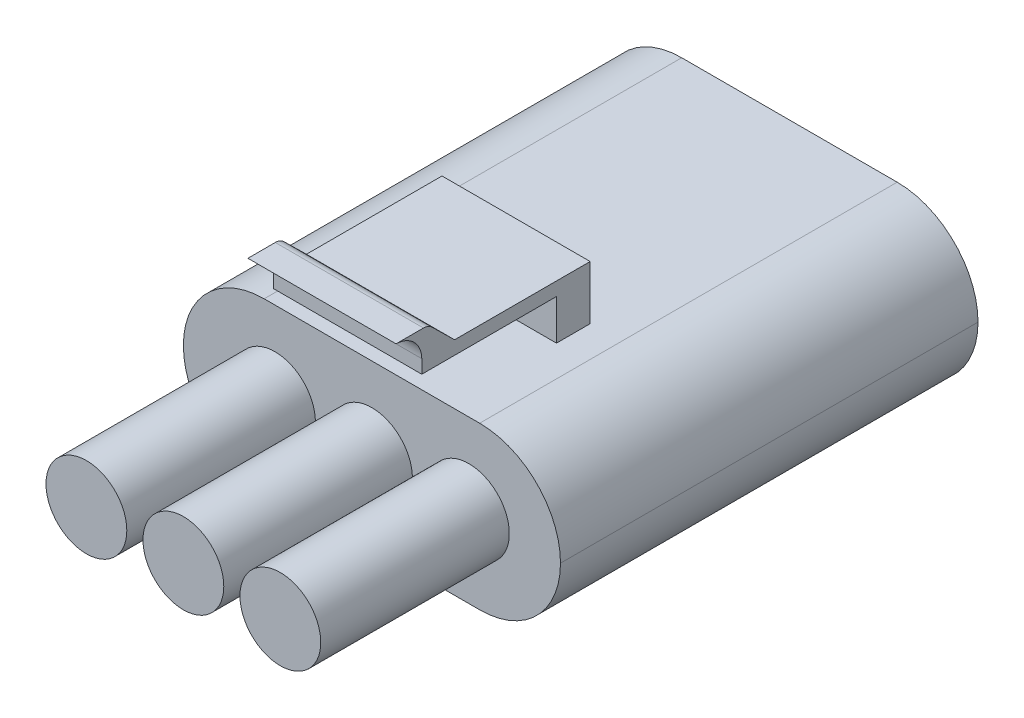
from build123d import *

# Parameters (mm, degrees)
SKETCH_1_W          = 28
SKETCH_1_H          = 12
EXTRUDE_1_DEPTH     = 31
FILLET_1_R          = 6
SKETCH_2_R          = 3
EXTRUDE_2_DEPTH     = 14
SKETCH_3_W          = 11
SKETCH_3_H          = 2.5
EXTRUDE_3_DEPTH     = 4
SKETCH_4_W          = 11
SKETCH_4_H          = 1
EXTRUDE_4_DEPTH     = 10
EXTRUDE_5_DEPTH     = 11
SKETCH_7_R          = 4.985468992
CUT_EXTRUDE_1_DEPTH = 1


with BuildPart() as part:
    # ｽｹｯﾁ1 → ﾎﾞｽ - 押し出し1 (new body)
    with BuildSketch(Plane.XY):
        with Locations((14, 6)):
            Rectangle(SKETCH_1_W, SKETCH_1_H)
    extrude(amount=EXTRUDE_1_DEPTH)

    # ﾌｨﾚｯﾄ1
    fillet_1_edges = [part.edges().sort_by_distance(p)[0] for p in [
        (28, 0, 15.5),
        (28, 12, 15.5),
        (0, 0, 15.5),
        (0, 12, 15.5),
    ]]
    fillet(fillet_1_edges, radius=FILLET_1_R - 0.0001)  # a hair under: the kernel refuses the full size

    # ｽｹｯﾁ2 → ﾎﾞｽ - 押し出し2 (add)
    with BuildSketch(Plane.XY.offset(31)):
        with Locations(Location((14, 6, 0), (0, 0, 180))):
            Circle(SKETCH_2_R)
        with Locations(Location((6.799424136, 6, 0), (0, 0, 180))):
            Circle(SKETCH_2_R)
        with Locations(Location((21.200575864, 6, 0), (0, 0, 180))):
            Circle(SKETCH_2_R)
    extrude(amount=EXTRUDE_2_DEPTH)

    # ｽｹｯﾁ3 → ﾎﾞｽ - 押し出し3 (add)
    with BuildSketch(Plane(origin=(0, 12, 0), x_dir=(1, 0, 0), z_dir=(0, 1, 0))):
        with Locations((14.202566522, -21.75)):
            Rectangle(SKETCH_3_W, SKETCH_3_H)
    extrude(amount=EXTRUDE_3_DEPTH)

    # ｽｹｯﾁ4 → ﾎﾞｽ - 押し出し4 (add)
    with BuildSketch(Plane.XY.offset(23)):
        with Locations((14.202566522, 15.5)):
            Rectangle(SKETCH_4_W, SKETCH_4_H)
    extrude(amount=EXTRUDE_4_DEPTH)

    # ｽｹｯﾁ6 → ﾎﾞｽ - 押し出し5 (add)
    with BuildSketch(Plane(origin=(19.702566522, 0, 0), x_dir=(0, 0, -1), z_dir=(1, 0, 0))):
        with BuildLine():
            Line((-32.878667376, 17.912838666), (-34.912838666, 17.912838666))
            ThreePointArc((-34.912838666, 17.912838666), (-33.572911973, 17.339926693), (-33, 16))
            Line((-33, 16), (-30.566032893, 16))
            Line((-30.566032893, 16), (-32.247451697, 17.654373362))
            ThreePointArc((-32.247451697, 17.654373362), (-32.537625756, 17.845719578), (-32.878667376, 17.912838666))
        make_face()
    extrude(amount=-EXTRUDE_5_DEPTH)

    # ｽｹｯﾁ7 → ｶｯﾄ - 押し出し1 (cut)
    with BuildSketch(Plane(origin=(0, 0, 0), x_dir=(-1, 0, 0), z_dir=(0, 0, -1))):
        with Locations((-14, 6.447278685)):
            Circle(SKETCH_7_R)
    extrude(amount=-CUT_EXTRUDE_1_DEPTH, mode=Mode.SUBTRACT)


solid = part.part
